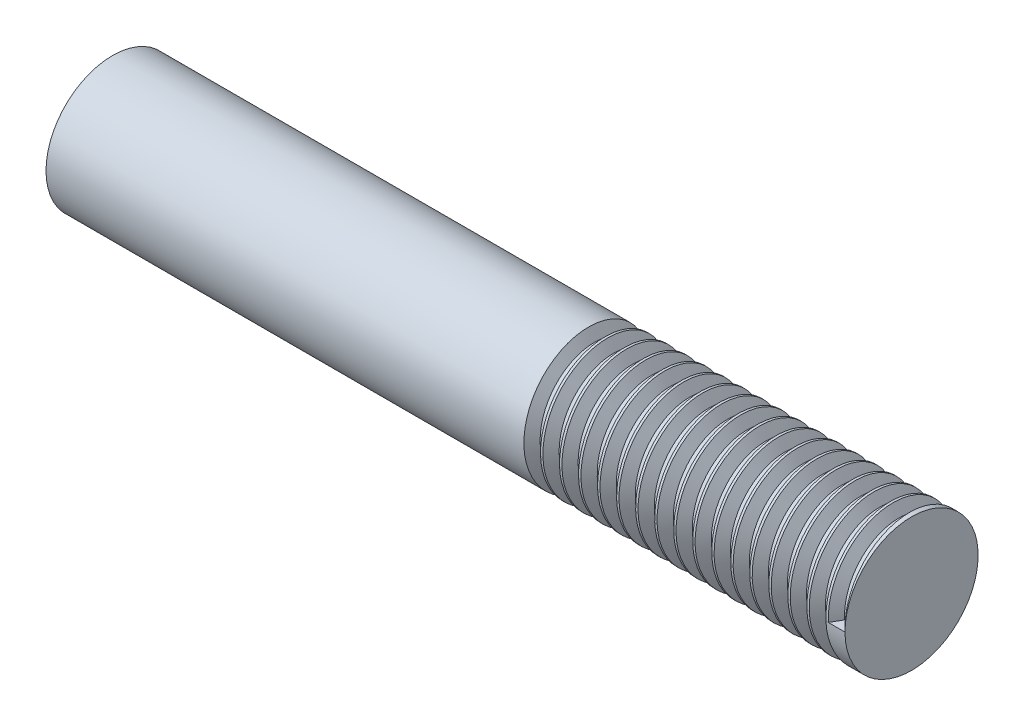
from build123d import *

# Parameters (mm, degrees)
SKETCH1_R           = 3.175
BOSS_EXTRUDE1_DEPTH = 38.1
THREAD1_PITCH       = 0.907142857


with BuildPart() as part:
    # Sketch1 → Boss-Extrude1 (new body)
    with BuildSketch(Plane(origin=(0, 0, 0), x_dir=(0, 0, -1), z_dir=(1, 0, 0))):
        with Locations(Location((0, 0, 0), (0, 0, 180))):
            Circle(SKETCH1_R)
    extrude(amount=BOSS_EXTRUDE1_DEPTH)

    # Thread1: the profile of Thread Profile1 profile screwed along a right-hand helix of 16.8 turns, 8 arcs to a turn; built about Z, then put on its axis
    thread1_z = Axis((0, 0, 0), (0, 0, 1))
    thread1_corners = [(3.1753, 0, -0.000173205), (3.1753, 0, 0.793923203), (2.683994528, 0, 0.510267856), (2.683994528, 0, 0.283482142)]
    with BuildLine(mode=Mode.PRIVATE) as thread1_profile:
        Line(thread1_corners[0], thread1_corners[1])
        Line(thread1_corners[1], thread1_corners[2])
        Line(thread1_corners[2], thread1_corners[3])
        Line(thread1_corners[3], thread1_corners[0])
    thread1_cap = Face(thread1_profile.wire())
    thread1_turn_angles = [0, 22.5, 45, 67.5, 90, 112.5, 135, 157.5, 180, 202.5, 225, 247.5, 270, 292.5, 315, 337.5, 360]
    thread1_turn_weights = [1, 0.9238795325112867, 1, 0.9238795325112867, 1, 0.9238795325112867, 1, 0.9238795325112867, 1, 0.9238795325112867, 1, 0.9238795325112867, 1, 0.9238795325112867, 1, 0.9238795325112867, 1]
    thread1_turn_rails = [Edge.make_bspline([Vector(p[0], p[1], 0).rotate(thread1_z, thread1_turn_angles[k]) / thread1_turn_weights[k] + Vector(0, 0, p[2] + THREAD1_PITCH * thread1_turn_angles[k] / 360) for k in range(17)], [0, 0, 0, 1, 1, 2, 2, 3, 3, 4, 4, 5, 5, 6, 6, 7, 7, 8, 8, 8], 2, thread1_turn_weights) for p in thread1_corners]
    thread1_turn_sides = [Face.make_surface_from_curves(thread1_turn_rails[p[0]], thread1_turn_rails[p[1]]) for p in [(0, 1), (1, 2), (2, 3), (3, 0)]]
    thread1_last_angles = [5760, 5782.5, 5805, 5827.5, 5850, 5872.5, 5895, 5917.5, 5940, 5962.5, 5985, 6007.5, 6030, 6039, 6048]
    thread1_last_weights = [1, 0.9238795325112867, 1, 0.9238795325112867, 1, 0.9238795325112867, 1, 0.9238795325112867, 1, 0.9238795325112867, 1, 0.9238795325112867, 1, 0.9876883405951378, 1]
    thread1_last_rails = [Edge.make_bspline([Vector(p[0], p[1], 0).rotate(thread1_z, thread1_last_angles[k]) / thread1_last_weights[k] + Vector(0, 0, p[2] + THREAD1_PITCH * thread1_last_angles[k] / 360) for k in range(15)], [0, 0, 0, 1, 1, 2, 2, 3, 3, 4, 4, 5, 5, 6, 6, 7, 7, 7], 2, thread1_last_weights) for p in thread1_corners]
    thread1_last_sides = [Face.make_surface_from_curves(thread1_last_rails[p[0]], thread1_last_rails[p[1]]) for p in [(0, 1), (1, 2), (2, 3), (3, 0)]]
    thread1 = Plane(origin=(38.1, 0, 0), x_dir=(0, 0, 1), z_dir=(-1, 0, 0)) * Solid(Shell([*[p.moved(Location((0, 0, THREAD1_PITCH * i))) for i in range(16) for p in thread1_turn_sides], *thread1_last_sides, thread1_cap, thread1_cap.rotate(thread1_z, 6048).moved(Location((0, 0, THREAD1_PITCH * 6048 / 360)))]))
    add(thread1, mode=Mode.SUBTRACT)


solid = part.part
